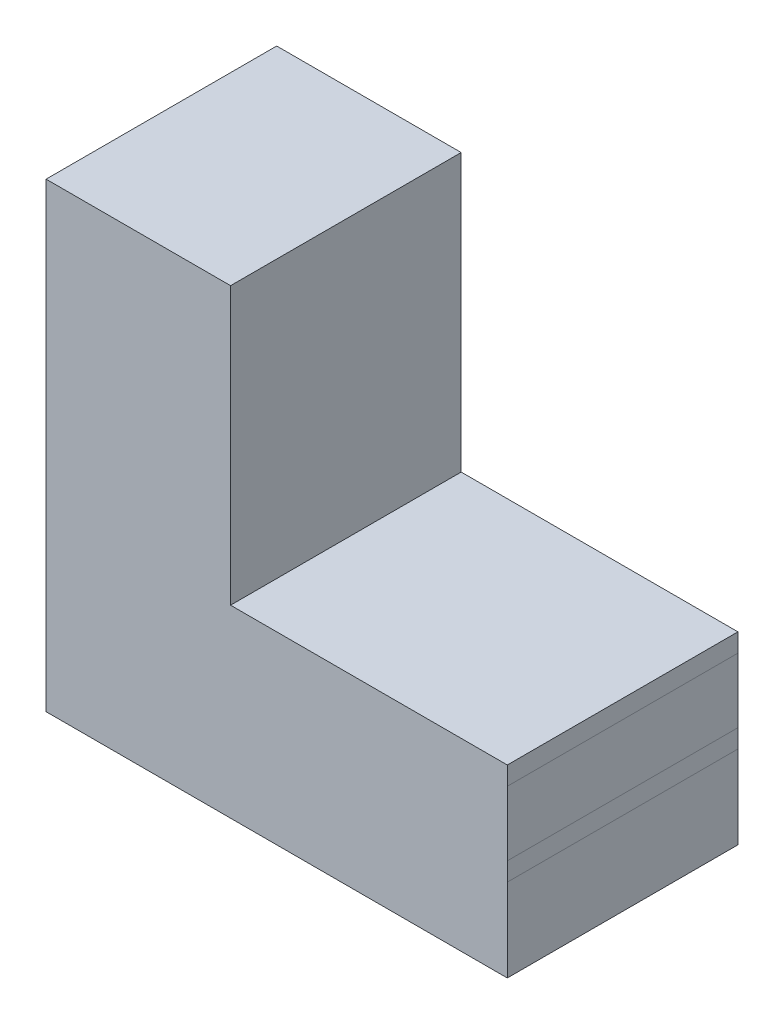
from build123d import *

# Parameters (mm, degrees)
BOSS_EXTRUDE1_DEPTH = 500


with BuildPart() as part:
    # Sketch1 → Boss-Extrude1 (new body)
    with BuildSketch(Plane.XY):
        Polygon((0, 0), (1000, 0), (1000, 400), (400, 400), (400, 1000), (0, 1000), align=None)
    extrude(amount=BOSS_EXTRUDE1_DEPTH)


solid = part.part
